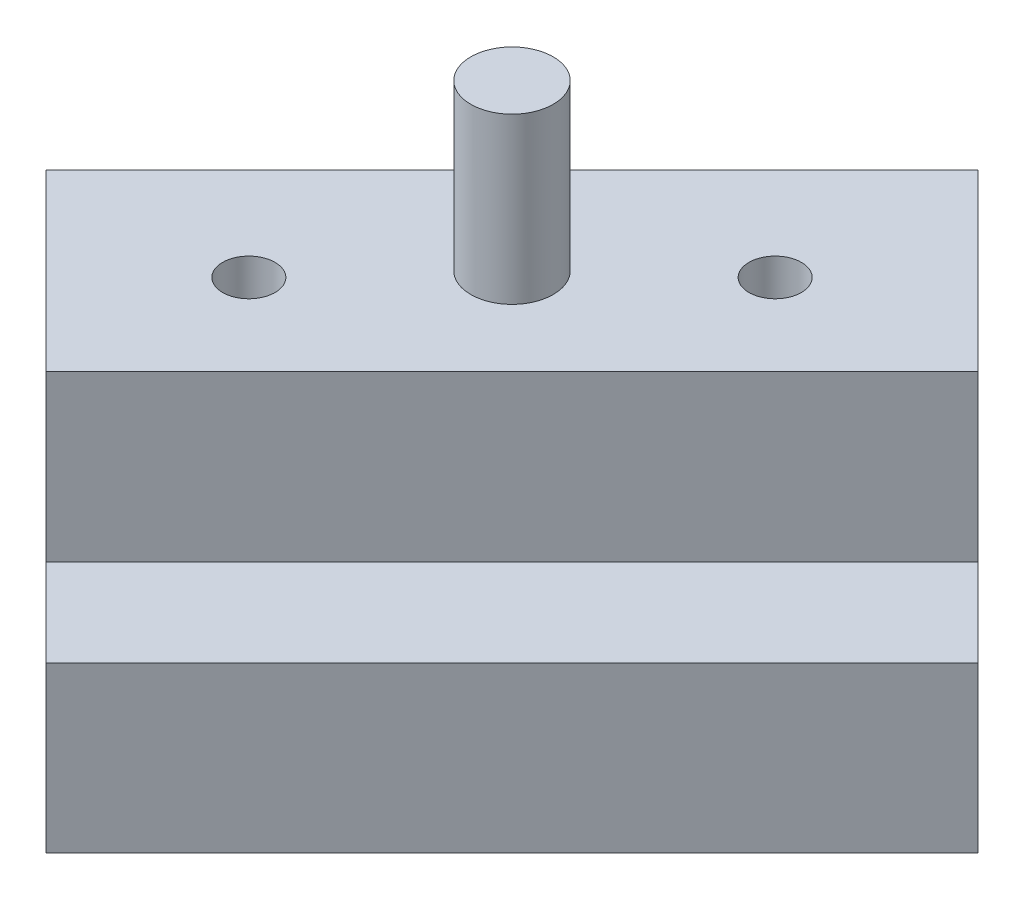
from build123d import *

# Parameters (mm, degrees)
BOSS_EXTRUDE1_DEPTH    = 25.4
F_10_32_TAPPED_HOLE1_D = 4.0386
SKETCH21_R             = 3.175
BOSS_EXTRUDE2_DEPTH    = 12.7
BODY_MOVE_COPY1_ANGLE  = 45


with BuildPart() as part:
    # Sketch1 → Boss-Extrude1 (new, symmetric)
    with BuildSketch(Plane(origin=(0, 0, 0), x_dir=(0, 0, -1), z_dir=(1, 0, 0))):
        Polygon((145.526233777, 219.072409282), (155.051233777, 219.072409282), (155.051233777, 231.772409282), (174.101233777, 231.772409282), (174.101233777, 206.372409282), (145.526233777, 206.372409282), align=None)
    extrude(amount=BOSS_EXTRUDE1_DEPTH, both=True)

    # #10-32 Tapped Hole1 (through all)
    with Locations(Plane(origin=(0, 231.772409282, 0), x_dir=(1, 0, 0), z_dir=(0, 1, 0))):
        with Locations((-14.343763893, 163.94997152), (14.343763893, 163.94997152)):
            Hole(F_10_32_TAPPED_HOLE1_D / 2)

    # Sketch21 → Boss-Extrude2 (add)
    with BuildSketch(Plane(origin=(0, 231.772409282, 0), x_dir=(1, 0, 0), z_dir=(0, 1, 0))):
        with Locations((0, 164.576233777)):
            Circle(SKETCH21_R)
    extrude(amount=BOSS_EXTRUDE2_DEPTH)


with BuildPart() as part_1:
    # Body-Move/Copy1: moved
    add(part.part.rotate(Axis((0, 0, 0), (0, 1, 0)), BODY_MOVE_COPY1_ANGLE))


solid = part_1.part
